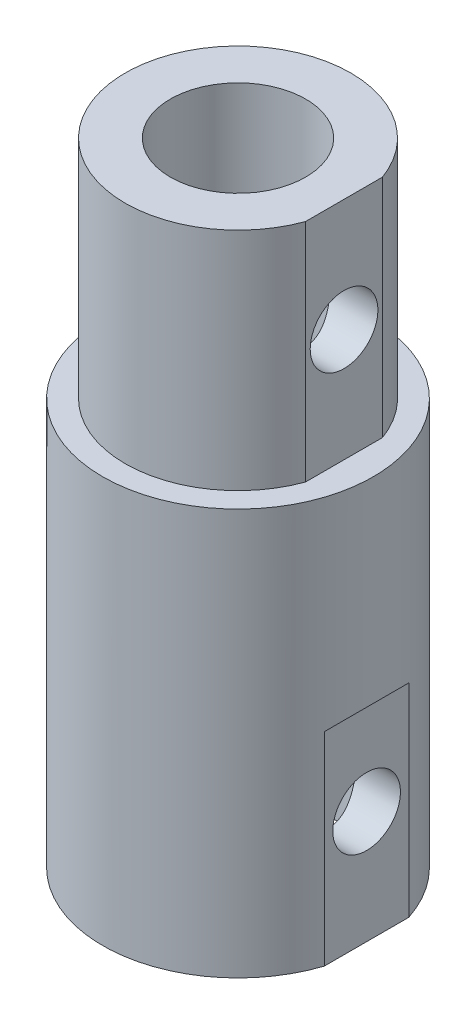
from build123d import *

# Parameters (mm, degrees)
SKETCH1_R           = 6
SKETCH1_R_2         = 4
BOSS_EXTRUDE1_DEPTH = 10
SKETCH2_R           = 6
BOSS_EXTRUDE2_DEPTH = 8
SKETCH3_R           = 5
SKETCH3_R_2         = 3
BOSS_EXTRUDE3_DEPTH = 10
SKETCH4_R           = 1.5
CUT_EXTRUDE1_DEPTH  = 10
SKETCH5_W           = 1.364712806
SKETCH5_H           = 6.528107361
CUT_EXTRUDE2_DEPTH  = 10
CHAMFER1_SIZE       = 1
SKETCH6_W           = 0.953233667
SKETCH6_H           = 4.701860643
CUT_EXTRUDE3_DEPTH  = 10


with BuildPart() as part:
    # Sketch1 → Boss-Extrude1 (new body)
    with BuildSketch(Plane(origin=(0, 0, 0), x_dir=(1, 0, 0), z_dir=(0, 1, 0))):
        with Locations(Location((0, 0, 0), (0, 0, 270))):
            Circle(SKETCH1_R)
        with Locations(Location((0, 0, 0), (0, 0, 270))):
            Circle(SKETCH1_R_2, mode=Mode.SUBTRACT)
    extrude(amount=BOSS_EXTRUDE1_DEPTH)

    # Sketch2 → Boss-Extrude2 (add)
    with BuildSketch(Plane(origin=(0, 10, 0), x_dir=(1, 0, 0), z_dir=(0, 1, 0))):
        with Locations(Location((0, 0, 0), (0, 0, 270))):
            Circle(SKETCH2_R)
    extrude(amount=BOSS_EXTRUDE2_DEPTH)

    # Sketch3 → Boss-Extrude3 (add)
    with BuildSketch(Plane(origin=(0, 18, 0), x_dir=(1, 0, 0), z_dir=(0, 1, 0))):
        with Locations(Location((0, 0, 0), (0, 0, 270))):
            Circle(SKETCH3_R)
        with Locations(Location((0, 0, 0), (0, 0, 270))):
            Circle(SKETCH3_R_2, mode=Mode.SUBTRACT)
    extrude(amount=BOSS_EXTRUDE3_DEPTH)

    # Sketch4 → Cut-Extrude1 (cut)
    with BuildSketch(Plane(origin=(0, 0, 0), x_dir=(0, 0, -1), z_dir=(1, 0, 0))):
        with Locations(Location((0, 5, 0), (0, 0, 180))):
            Circle(SKETCH4_R)
        with Locations(Location((0, 23, 0), (0, 0, 180))):
            Circle(SKETCH4_R)
    extrude(amount=CUT_EXTRUDE1_DEPTH, mode=Mode.SUBTRACT)

    # Sketch5 → Cut-Extrude2 (cut)
    with BuildSketch(Plane.XZ):
        with Locations((6.382356403, -0.325289304)):
            Rectangle(SKETCH5_W, SKETCH5_H)
    extrude(amount=-CUT_EXTRUDE2_DEPTH, mode=Mode.SUBTRACT)

    # Chamfer1
    # the kernel refuses this chamfer: 1 mm, written as the material it adds along each edge
    with BuildSketch(Plane(origin=(5.7, 10, -4.445182387), x_dir=(-0.02749587661058651, -0.9996219169112968, 0), z_dir=(0, 0, 1))) as chamfer1_piece_1_section:
        Polygon((CHAMFER1_SIZE * 0.999621916911, CHAMFER1_SIZE * 0.0274958766106), (-CHAMFER1_SIZE * 0.0274958766106, CHAMFER1_SIZE * 0.999621916911), (0, 0), align=None)
    chamfer1_piece_1 = extrude(amount=8.890364775, mode=Mode.PRIVATE)
    chamfer1_piece_1 = chamfer1_piece_1 & Plane(origin=(0, 9.556619027, 0), x_dir=(0, 0, 1), z_dir=(0, -1, 0)) * Cylinder(6, 22, mode=Mode.PRIVATE)
    add(chamfer1_piece_1)

    # Sketch6 → Cut-Extrude3 (cut)
    with BuildSketch(Plane(origin=(0, 28, 0), x_dir=(1, 0, 0), z_dir=(0, 1, 0))):
        with Locations((5.176616834, 0.047714229)):
            Rectangle(SKETCH6_W, SKETCH6_H)
    extrude(amount=-CUT_EXTRUDE3_DEPTH, mode=Mode.SUBTRACT)


solid = part.part
